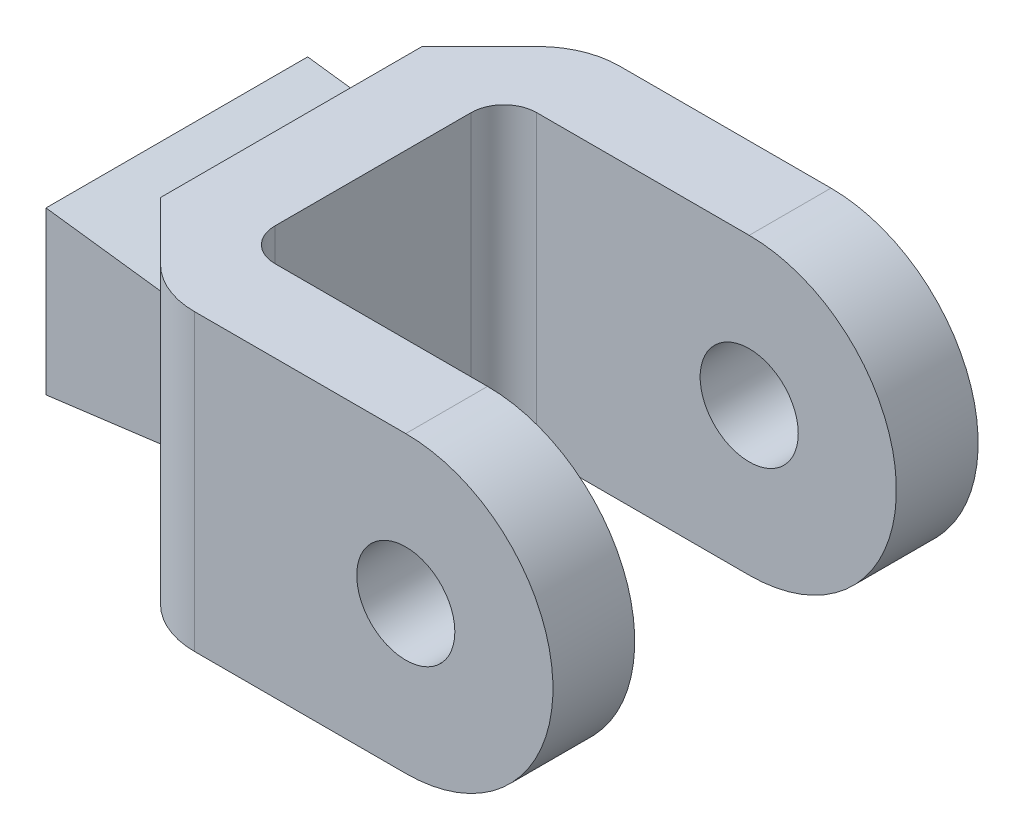
from build123d import *

# Parameters (mm, degrees)
BOSS_EXTRUDE1_DEPTH  = 8
SKETCH2_R            = 1.5
BOSS_EXTRUDE3_DEPTH  = 2.5
CUT_EXTRUDE2_DEPTH   = 19.663132106
FILLET5_R            = 1
FILLET6_R            = 2.5
FILLET5_OF_MIRROR2_R = 1
FILLET6_OF_MIRROR2_R = 2.5


with BuildPart() as part:
    # Sketch1 → Boss-Extrude1 (new body)
    with BuildSketch(Plane.XY):
        Polygon((-1.75, -2.475), (-1.75, 2.475), (1.75, 2.025), (1.75, 4.5), (4.25, 4.5), (4.25, -4.5), (1.75, -4.5), (1.75, -2.025), align=None)
    extrude(amount=BOSS_EXTRUDE1_DEPTH)

    # Sketch2 → Boss-Extrude3 (add)
    with BuildSketch(Plane.XY):
        with BuildLine():
            Line((11.75, -4.5), (1.75, -4.5))
            Line((1.75, -4.5), (1.75, 4.5))
            Line((1.75, 4.5), (11.75, 4.5))
            ThreePointArc((11.75, 4.5), (16.25, 0), (11.75, -4.5))
        make_face()
        with Locations((11.75, 0)):
            Circle(SKETCH2_R, mode=Mode.SUBTRACT)
    boss_extrude3 = extrude(amount=-BOSS_EXTRUDE3_DEPTH)

    # Sketch5 → Cut-Extrude2 (cut, symmetric)
    with BuildSketch(Plane(origin=(0, 0, 0), x_dir=(1, 0, 0), z_dir=(0, 1, 0))):
        Polygon((1.75, 0), (4.25, 2.5), (1.75, 2.5), align=None)
    cut_extrude2 = extrude(amount=CUT_EXTRUDE2_DEPTH, both=True, mode=Mode.SUBTRACT)

    # Fillet5
    fillet5_edges = [part.edges().sort_by_distance(p)[0] for p in [
        (4.25, 0, 0),
    ]]
    fillet(fillet5_edges, radius=FILLET5_R)

    # Fillet6
    fillet6_edges = [part.edges().sort_by_distance(p)[0] for p in [
        (4.25, 0, -2.5),
    ]]
    fillet(fillet6_edges, radius=FILLET6_R)

    # Mirror2: Boss-Extrude3, Cut-Extrude2 across plane
    add(boss_extrude3.mirror(Plane(origin=(0, 0, 4), x_dir=(1, 0, 0), z_dir=(0, 0, -1))))
    add(cut_extrude2.mirror(Plane(origin=(0, 0, 4), x_dir=(1, 0, 0), z_dir=(0, 0, -1))), mode=Mode.SUBTRACT)

    # Fillet5 of Mirror2
    fillet5_of_mirror2_edges = [part.edges().sort_by_distance(p)[0] for p in [
        (4.25, 0, 8),
    ]]
    fillet(fillet5_of_mirror2_edges, radius=FILLET5_OF_MIRROR2_R)

    # Fillet6 of Mirror2
    fillet6_of_mirror2_edges = [part.edges().sort_by_distance(p)[0] for p in [
        (4.25, 0, 10.5),
    ]]
    fillet(fillet6_of_mirror2_edges, radius=FILLET6_OF_MIRROR2_R)


solid = part.part
